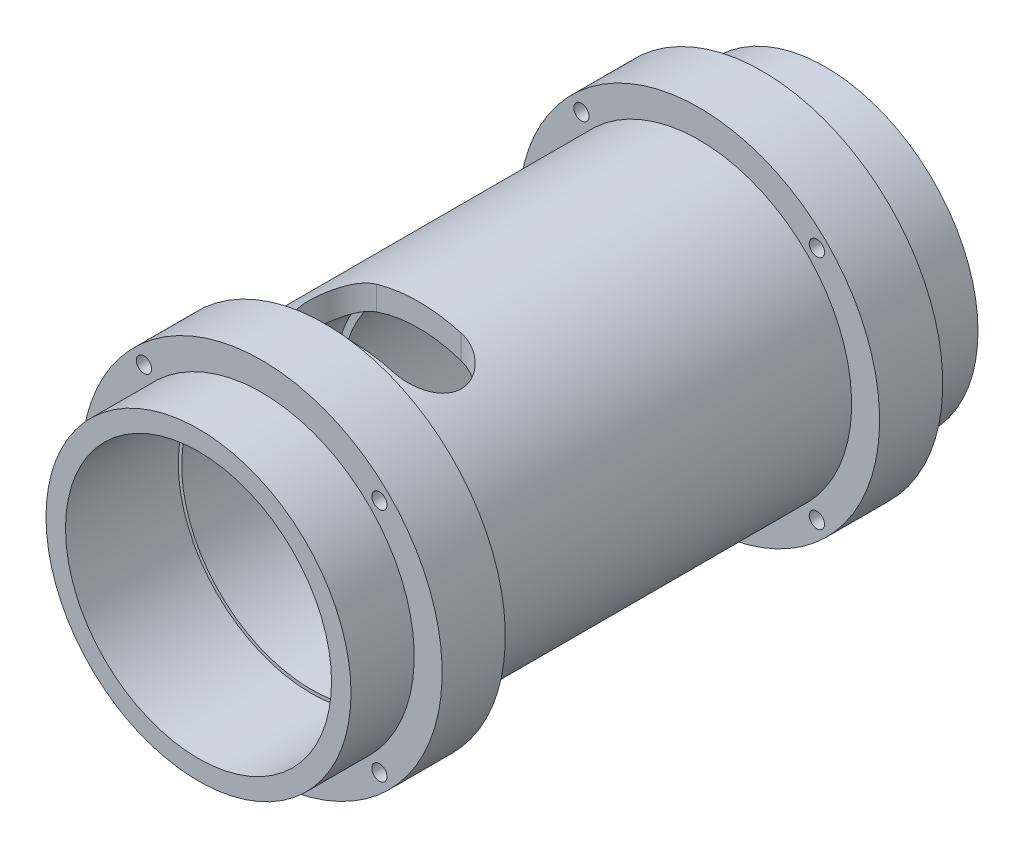
from build123d import *

# Parameters (mm, degrees)
SKETCH1_R            = 45
SKETCH1_R_2          = 33.75
BOSS_EXTRUDE1_DEPTH  = 92.5
CUT_EXTRUDE1_DEPTH   = 113.277557864
SKETCH4_W            = 18.64178708
SKETCH4_H            = 8.25
M4_CLEARANCE_HOLE1_D = 4.5


with BuildPart() as part:
    # Sketch1 → Boss-Extrude1 (new, symmetric)
    with BuildSketch(Plane.XY):
        Circle(SKETCH1_R)
        Circle(SKETCH1_R_2, mode=Mode.SUBTRACT)
    extrude(amount=BOSS_EXTRUDE1_DEPTH, both=True)

    # Sketch2 → Cut-Revolve1 (revolve, cut)
    with BuildSketch(Plane(origin=(0, 0, 0), x_dir=(1, 0, 0), z_dir=(0, 1, 0))):
        Polygon((0, -92.5), (0, 92.5), (-38.25, 92.5), (-38.25, 86.15), (-36.25, 86.15), (-36.25, -13.85), (-38.25, -13.85), (-38.25, -59.21294831), (-39.25, -59.21294831), (-39.25, -92.5), align=None)
    revolve(axis=Axis((0, 0, 92.5), (0, 0, -1)), mode=Mode.SUBTRACT)

    # Sketch3 → Cut-Extrude1 (cut, through all)
    with BuildSketch(Plane(origin=(0, 0, 0), x_dir=(1, 0, 0), z_dir=(0, 1, 0))):
        with BuildLine():
            Line((-12.5, -27.5), (12.5, -27.5))
            ThreePointArc((12.5, -27.5), (22.5, -37.5), (12.5, -47.5))
            Line((12.5, -47.5), (-12.5, -47.5))
            ThreePointArc((-12.5, -47.5), (-22.5, -37.5), (-12.5, -27.5))
        make_face()
    extrude(amount=CUT_EXTRUDE1_DEPTH, mode=Mode.SUBTRACT)

    # Sketch4 → Revolve1 (revolve)
    with BuildSketch(Plane(origin=(0, 0, 0), x_dir=(0, 0, -1), z_dir=(1, 0, 0))):
        with Locations((-64.53731938, 49.125)):
            Rectangle(SKETCH4_W, SKETCH4_H)
        with Locations((64.53731938, 49.125)):
            Rectangle(SKETCH4_W, SKETCH4_H)
    revolve(axis=Axis((0, 0, -92.5), (0, 0, 1)))

    # M4 Clearance Hole1 (through all)
    with Locations(Plane.XY.offset(73.85821292)):
        with Locations((34.736620626, -34.736620626), (-34.736620626, 34.736620626), (34.736620626, 34.736620626), (-34.736620626, -34.736620626)):
            Hole(M4_CLEARANCE_HOLE1_D / 2)


solid = part.part
